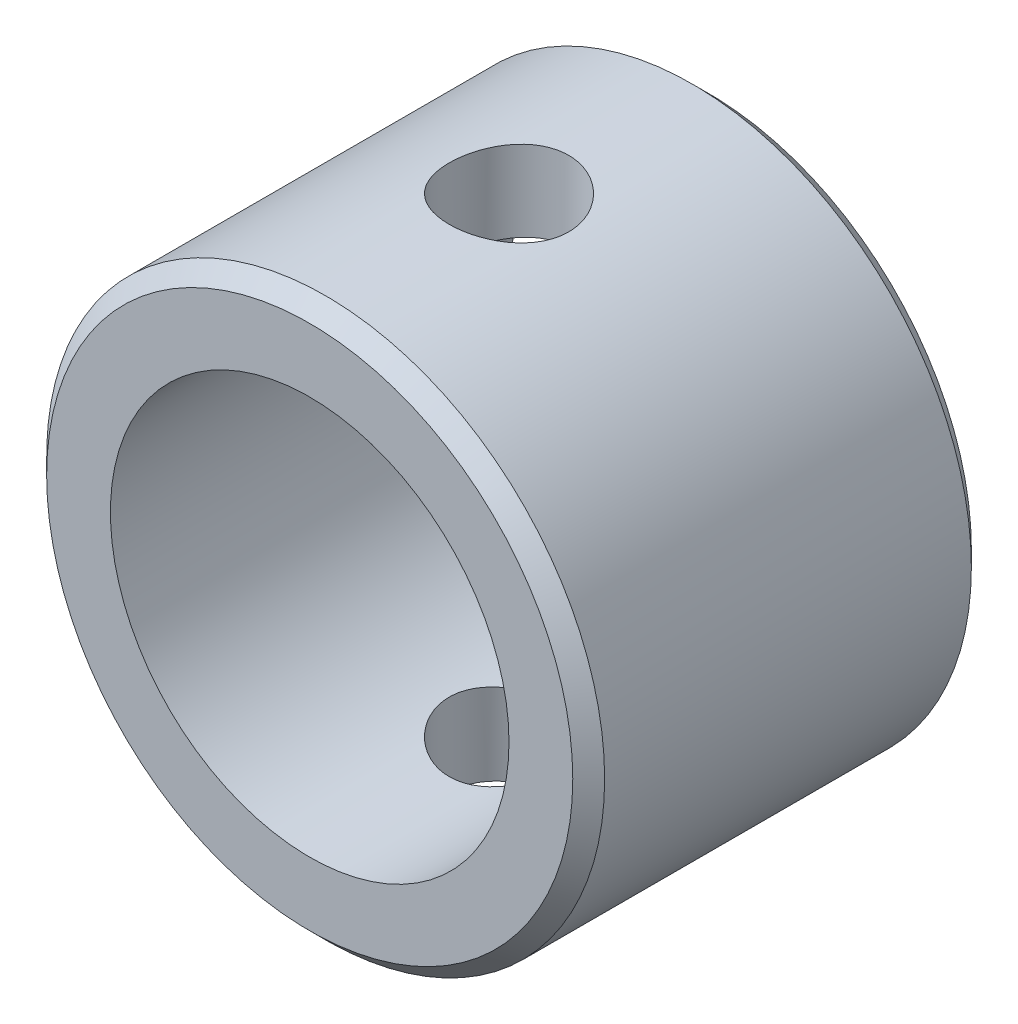
from build123d import *

# Parameters (mm, degrees)
ESQUISSE1_R             = 3.5
ESQUISSE1_R_2           = 2.5
BASE_EXTRU_MINCE_DEPTH  = 2.5
CHANFREIN1_SIZE         = 0.2
ESQUISSE2_R             = 0.75
ENL_V_MAT_EXTRU_1_DEPTH = 5


with BuildPart() as part:
    # Esquisse1 → Base-Extru.-Mince (new, symmetric)
    with BuildSketch(Plane.XY):
        Circle(ESQUISSE1_R)
        Circle(ESQUISSE1_R_2, mode=Mode.SUBTRACT)
    extrude(amount=BASE_EXTRU_MINCE_DEPTH, both=True)

    # Chanfrein1
    chanfrein1_edges = [part.edges().sort_by_distance(p)[0] for p in [
        (-3.5, 0, -2.5),
        (-3.5, 0, 2.5),
    ]]
    chamfer(chanfrein1_edges, length=CHANFREIN1_SIZE)

    # Esquisse2 → Enlèv. mat.-Extru.1 (cut, symmetric)
    with BuildSketch(Plane(origin=(0, 0, 0), x_dir=(1, 0, 0), z_dir=(0, 1, 0))):
        with Locations(Location((0, 0, 0), (0, 0, 270))):
            Circle(ESQUISSE2_R)
    extrude(amount=ENL_V_MAT_EXTRU_1_DEPTH, both=True, mode=Mode.SUBTRACT)


solid = part.part
